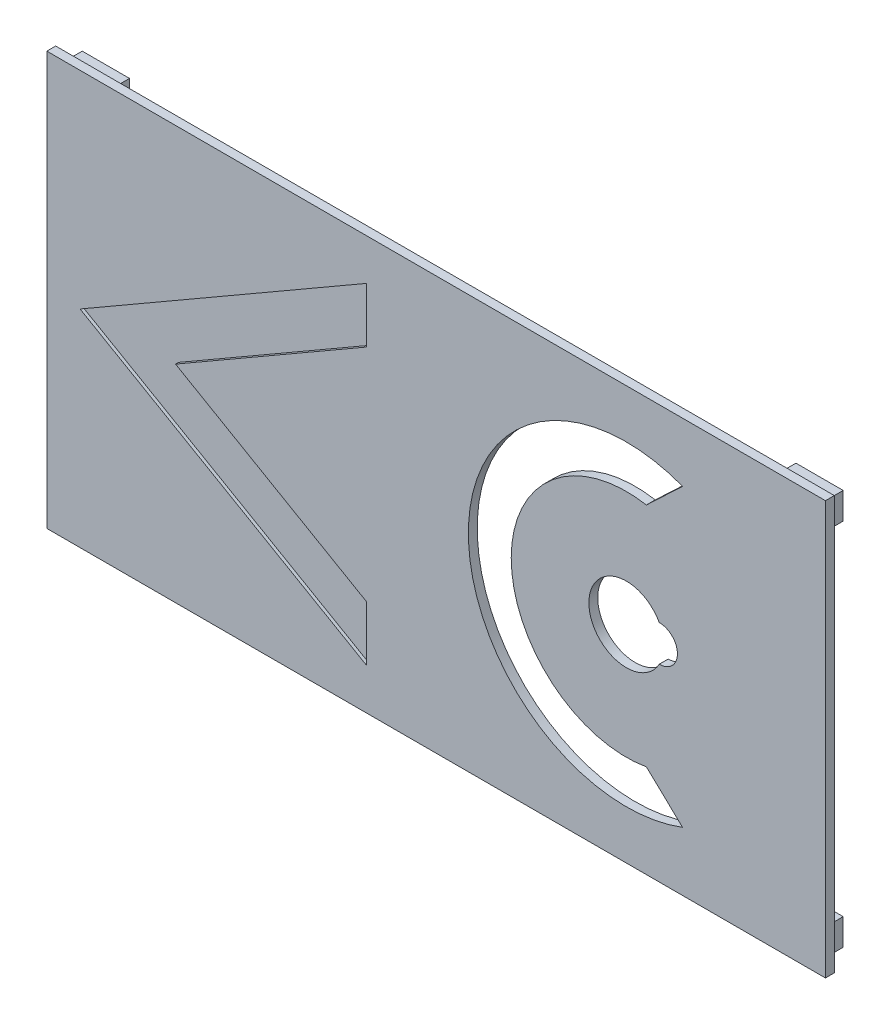
from build123d import *

# Parameters (mm, degrees)
SKETCH1_W                 = 131.85
SKETCH1_H                 = 70
BOSS_EXTRUDE1_DEPTH       = 1.5
CUT_EXTRUDE1_REACH        = 137.268
SKETCH4_W                 = 8
SKETCH4_H                 = 4.5
SKETCH4_W_2               = 5
SKETCH4_H_2               = 1.5
BOSS_EXTRUDE2_DEPTH       = 3
MIRROR2_COPY_1_SKETCH_W   = 8
MIRROR2_COPY_1_SKETCH_H   = 4.5
MIRROR2_COPY_1_SKETCH_W_2 = 5
MIRROR2_COPY_1_SKETCH_H_2 = 1.5
MIRROR2_COPY_1_DEPTH      = 3
CUT_EXTRUDE2_REACH        = 137.335
CUT_EXTRUDE3_DEPTH        = 0.5


with BuildPart() as part:
    # Sketch1 → Boss-Extrude1 (new body)
    with BuildSketch(Plane.XY):
        with Locations((55.175, 25.25)):
            Rectangle(SKETCH1_W, SKETCH1_H)
    extrude(amount=BOSS_EXTRUDE1_DEPTH)

    # Sketch2 → Cut-Extrude1 (cut, up to next)
    with BuildSketch(Plane.XY.offset(1.5), mode=Mode.PRIVATE) as cut_extrude1_sk1:
        with BuildLine():
            Line((92.957060126, 22.2), (92.9875, 22.2))
            ThreePointArc((92.9875, 22.2), (96.0375, 25.25), (92.9875, 28.3))
            Line((92.9875, 28.3), (92.957060126, 28.3))
            ThreePointArc((92.957060126, 28.3), (81.0375, 25.25), (92.957060126, 22.2))
        make_face()
    cut_extrude1_tool1 = extrude(cut_extrude1_sk1.sketch, amount=-CUT_EXTRUDE1_REACH, mode=Mode.PRIVATE) & part.part
    add(cut_extrude1_tool1.solids().sort_by_distance((87.98685, 25.25, 1.5))[0], mode=Mode.SUBTRACT)

    # Sketch4 → Boss-Extrude2 (add)
    with BuildSketch(Plane(origin=(0, 0, 0), x_dir=(-1, 0, 0), z_dir=(0, 0, -1))):
        with Locations((-115.6, 56.5)):
            Rectangle(SKETCH4_W, SKETCH4_H)
        with Locations((-115.6, 56.5)):
            Rectangle(SKETCH4_W_2, SKETCH4_H_2, mode=Mode.SUBTRACT)
    boss_extrude2 = extrude(amount=BOSS_EXTRUDE2_DEPTH)

    # Mirror1: Boss-Extrude2 across plane
    add(boss_extrude2.mirror(Plane.ZX.offset(25.25)))

    # Mirror2: Boss-Extrude2 across plane
    add(boss_extrude2.mirror(Plane(origin=(55.175, 0, 0), x_dir=(0, 0, 1), z_dir=(1, 0, 0))))

    # Mirror2 copy 1 sketch → Mirror2 copy 1 (add)
    with BuildSketch(Plane(origin=(110.35, 50.5, 0), x_dir=(1, 0, 0), z_dir=(0, 0, -1))):
        with Locations((-115.6, 56.5)):
            Rectangle(MIRROR2_COPY_1_SKETCH_W, MIRROR2_COPY_1_SKETCH_H)
        with Locations((-115.6, 56.5)):
            Rectangle(MIRROR2_COPY_1_SKETCH_W_2, MIRROR2_COPY_1_SKETCH_H_2, mode=Mode.SUBTRACT)
    extrude(amount=MIRROR2_COPY_1_DEPTH)

    # Sketch5 → Cut-Extrude2 (cut, up to next)
    with BuildSketch(Plane.XY.offset(1.5), mode=Mode.PRIVATE) as cut_extrude2_sk1:
        with BuildLine():
            Line((90.774215328, 6.046350365), (96.908092333, 0.244034279))
            ThreePointArc((96.908092333, 0.244034279), (60.630444856, 25.25), (96.908092333, 50.255965721))
            Line((96.908092333, 50.255965721), (90.774215328, 44.453649635))
            ThreePointArc((90.774215328, 44.453649635), (67.8875, 25.25), (90.774215328, 6.046350365))
        make_face()
    cut_extrude2_tool1 = extrude(cut_extrude2_sk1.sketch, amount=-CUT_EXTRUDE2_REACH, mode=Mode.PRIVATE) & part.part
    add(cut_extrude2_tool1.solids().sort_by_distance((67.240984, 25.25, 1.5))[0], mode=Mode.SUBTRACT)

    # Sketch6 → Cut-Extrude3 (cut)
    with BuildSketch(Plane.XY.offset(1.5)):
        Polygon((-5.119922612, 25.25), (43.3775, -2.75), (43.3775, 6.583333333), (11.045884925, 25.25), (43.3775, 43.916666667), (43.3775, 53.25), align=None)
    extrude(amount=-CUT_EXTRUDE3_DEPTH, mode=Mode.SUBTRACT)


solid = part.part
